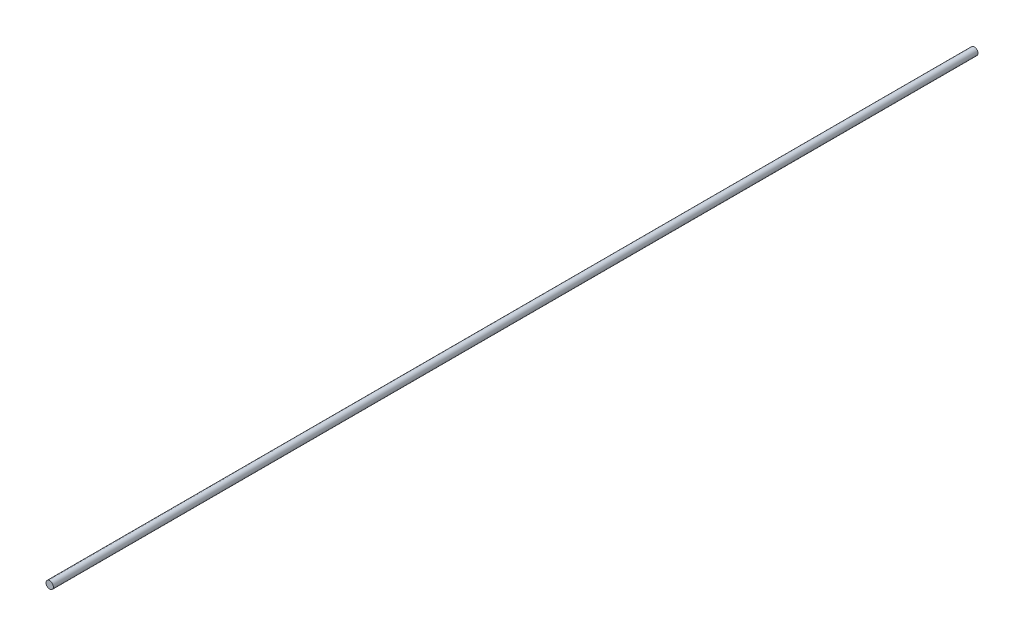
from build123d import *

# Parameters (mm, degrees)
ESQUISSE1_R        = 4
BOSS_EXTRU_1_DEPTH = 1000


with BuildPart() as part:
    # Esquisse1 → Boss.-Extru.1 (new body)
    with BuildSketch(Plane.XY):
        Circle(ESQUISSE1_R)
    extrude(amount=BOSS_EXTRU_1_DEPTH)


solid = part.part
